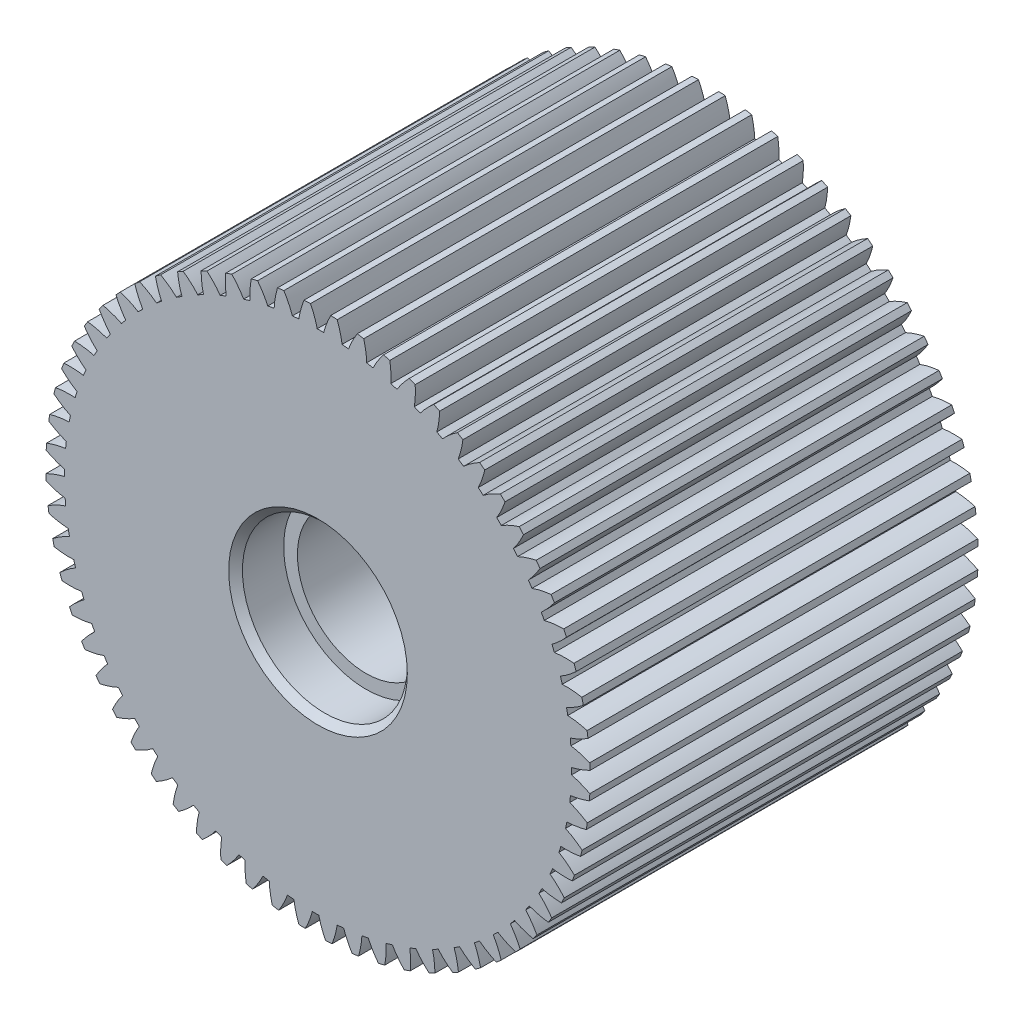
from build123d import *

# Parameters (mm, degrees)
SKETCH1_R               = 19.8
BOSS_EXTRUDE1_DEPTH     = 14.115772505
CUT_EXTRUDE1_DEPTH      = 32.358173311
CIRPATTERN2_COUNT       = 64
CUT_EXTRUDE2_DEPTH      = 40.755598044
CUT_EXTRUDE2_DEPTH_BACK = 40.755598044
SKETCH3_R               = 5
SKETCH4_R               = 6
CUT_EXTRUDE3_DEPTH      = 3.5
CHAMFER1_SIZE           = 0.5


with BuildPart() as part:
    # Sketch1 → Boss-Extrude1 (new, symmetric)
    with BuildSketch(Plane.XY):
        Circle(SKETCH1_R)
    extrude(amount=BOSS_EXTRUDE1_DEPTH, both=True)

    # Sketch2 → Cut-Extrude1 (cut, symmetric)
    with BuildSketch(Plane.XY):
        with BuildLine():
            ThreePointArc((18.449907129, 0.058540091), (18.449976782, 0.029270082), (18.45, 0))
            ThreePointArc((18.45, 0), (18.449142854, -0.177842493), (18.446571496, -0.355668461))
            ThreePointArc((18.446571496, -0.355668461), (18.44598403, -0.384932657), (18.44535014, -0.414195884))
            add(Edge.make_bspline(
                [(18.44535014, -0.414195884), (18.447814849, -0.414781036), (18.480814418, -0.422645995), (18.544173515, -0.438527703), (18.637496848, -0.463996052), (18.757705814, -0.500242185), (18.877054071, -0.539449074), (18.995401255, -0.581248906), (19.138064007, -0.635109174), (19.30813226, -0.704171245), (19.489847771, -0.784530387), (19.640146936, -0.856216728), (19.737410563, -0.904892599), (19.778345531, -0.9257689)],
                knots=[0.089902124, 0.089902124, 0.089902124, 0.089902124, 0.089902124, 0.092110525, 0.119476176, 0.146842496, 0.174208854, 0.201574956, 0.228941013, 0.256307345, 0.307035032, 0.361767352, 0.40177969, 0.40177969, 0.40177969, 0.40177969, 0.40177969], degree=4))
            ThreePointArc((19.778345531, -0.9257689), (19.794585642, -0.463011062), (19.8, 0))
            ThreePointArc((19.8, 0), (19.798129067, 0.272186383), (19.792516624, 0.544321327))
            add(Edge.make_bspline(
                [(18.449907129, 0.058540091), (18.452382661, 0.059077622), (18.485527713, 0.066304972), (18.549181195, 0.080962329), (18.64297815, 0.104626912), (18.76386351, 0.138548991), (18.883945397, 0.175447867), (19.003076382, 0.214958502), (19.14675091, 0.266058591), (19.318118899, 0.331829351), (19.50134976, 0.408670554), (19.653002923, 0.477446193), (19.751186821, 0.524238026), (19.792516624, 0.544321327)],
                knots=[0.089902124, 0.089902124, 0.089902124, 0.089902124, 0.089902124, 0.092110525, 0.119476176, 0.146842496, 0.174208854, 0.201574956, 0.228941013, 0.256307345, 0.307035032, 0.361767352, 0.40177969, 0.40177969, 0.40177969, 0.40177969, 0.40177969], degree=4))
        make_face()
    cut_extrude1 = extrude(amount=CUT_EXTRUDE1_DEPTH, both=True, mode=Mode.SUBTRACT)

    # CirPattern2: Cut-Extrude1 ×64 about axis
    cirpattern2_axis = Axis((0, 0, -14.115772505), (0, 0, 1))
    for i in range(1, CIRPATTERN2_COUNT):
        add(cut_extrude1.rotate(cirpattern2_axis, i * 360 / CIRPATTERN2_COUNT), mode=Mode.SUBTRACT)

    # Sketch3 → Cut-Extrude2 (cut, two sides: drawn at the far end of the back side and taken through both)
    with BuildSketch(Plane.XY.offset(14.115772505).offset(-CUT_EXTRUDE2_DEPTH_BACK)):
        Circle(SKETCH3_R)
    extrude(amount=CUT_EXTRUDE2_DEPTH + CUT_EXTRUDE2_DEPTH_BACK, mode=Mode.SUBTRACT)

    # Sketch4 → Cut-Extrude3 (cut)
    with BuildSketch(Plane.XY.offset(14.115772505)):
        Circle(SKETCH4_R)
    cut_extrude3 = extrude(amount=-CUT_EXTRUDE3_DEPTH, mode=Mode.SUBTRACT)

    # Mirror2: Cut-Extrude3 across plane
    add(cut_extrude3.mirror(Plane.XY), mode=Mode.SUBTRACT)

    # Chamfer1
    chamfer1_edges = [part.edges().sort_by_distance(p)[0] for p in [
        (-6, 0, 14.115772505),
        (-6, 0, -14.115772505),
    ]]
    chamfer(chamfer1_edges, length=CHAMFER1_SIZE)


solid = part.part
